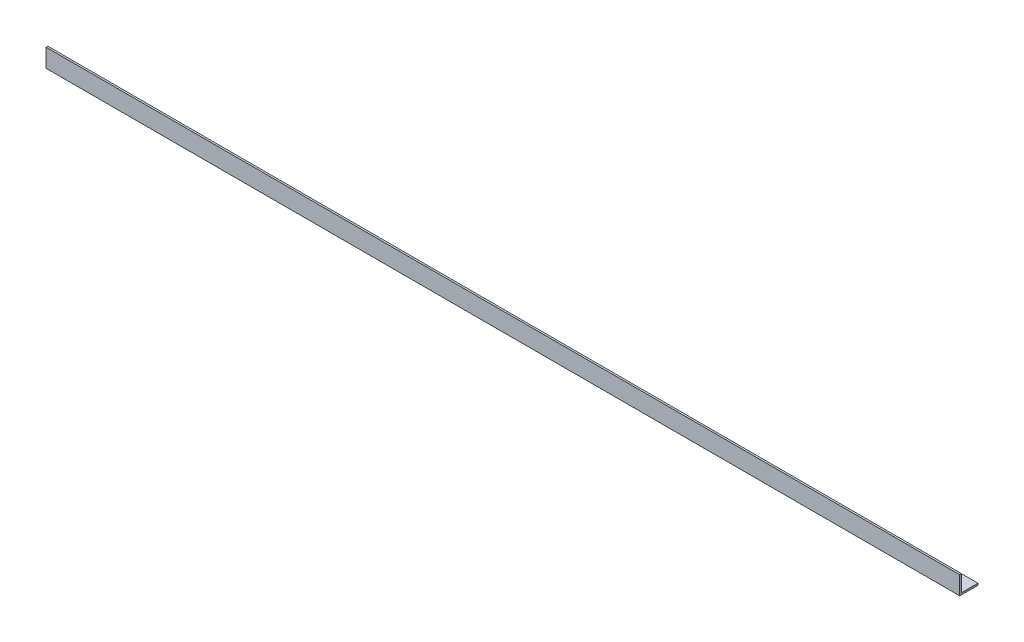
from build123d import *

# Parameters (mm, degrees)
EXTRUDE_1_DEPTH = 2500


with BuildPart() as part:
    # Эскиз1 → Вытянуть-Тонкостенный1 (new body)
    with BuildSketch(Plane(origin=(0, 0, 0), x_dir=(0, 0, -1), z_dir=(1, 0, 0))):
        Polygon((0, 50), (0, 0), (50, 0), (50, 5), (5, 5), (5, 50), align=None)
    extrude(amount=EXTRUDE_1_DEPTH)


solid = part.part
